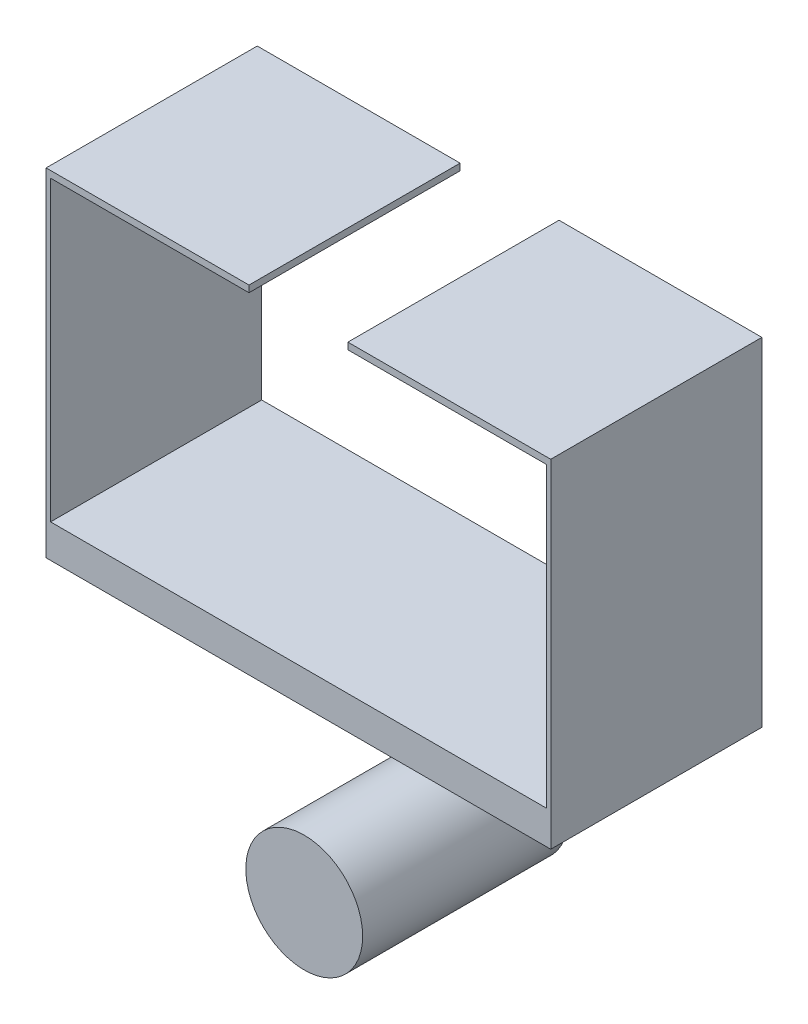
from build123d import *

# Parameters (mm, degrees)
SKETCH1_R           = 7.472749452
BOSS_EXTRUDE1_DEPTH = 25.4
BOSS_EXTRUDE2_DEPTH = 0.863350236
SKETCH4_W           = 63.40856
SKETCH4_H           = 4.26981756
BOSS_EXTRUDE3_DEPTH = 27.00421054
SKETCH6_W           = 27.00421054
SKETCH6_H           = 4.26981756
BOSS_EXTRUDE4_DEPTH = 0.56888896
SKETCH7_W           = 0.56888896
SKETCH7_H           = 27.00421054
BOSS_EXTRUDE5_DEPTH = 38.0746
SKETCH8_W           = 0.56888896
SKETCH8_H           = 27.00421054
BOSS_EXTRUDE6_DEPTH = 0.853447309
SKETCH9_W           = 27.00421054
SKETCH9_H           = 0.853447309
BOSS_EXTRUDE7_DEPTH = 25.37968


with BuildPart() as part:
    # Sketch1 → Boss-Extrude1 (new body)
    with BuildSketch(Plane.XY):
        Circle(SKETCH1_R)
    extrude(amount=-BOSS_EXTRUDE1_DEPTH)

    # Sketch2 → Boss-Extrude2 (add)
    with BuildSketch(Plane(origin=(0, 0, -25.4), x_dir=(-1, 0, 0), z_dir=(0, 0, -1))):
        with BuildLine():
            Line((-7.472749452, 22.418248356), (-7.472749452, 0))
            ThreePointArc((-7.472749452, 0), (0, -7.472749452), (7.472749452, 0))
            Line((7.472749452, 0), (7.472749452, 22.418248356))
            Line((7.472749452, 22.418248356), (-7.472749452, 22.418248356))
        make_face()
    extrude(amount=BOSS_EXTRUDE2_DEPTH)

    # Sketch4 → Boss-Extrude3 (add)
    with BuildSketch(Plane(origin=(0, 0, -26.263350236), x_dir=(-1, 0, 0), z_dir=(0, 0, -1))):
        with Locations((0, 24.553157136)):
            Rectangle(SKETCH4_W, SKETCH4_H)
    extrude(amount=-BOSS_EXTRUDE3_DEPTH)

    # Sketch6 → Boss-Extrude4 (add)
    with BuildSketch(Plane(origin=(31.70428, 0, 0), x_dir=(0, 0, -1), z_dir=(1, 0, 0))):
        with Locations((12.761244966, 24.553157136)):
            Rectangle(SKETCH6_W, SKETCH6_H)
    boss_extrude4 = extrude(amount=BOSS_EXTRUDE4_DEPTH)

    # Sketch7 → Boss-Extrude5 (add)
    with BuildSketch(Plane(origin=(0, 26.688065916, 0), x_dir=(1, 0, 0), z_dir=(0, 1, 0))):
        with Locations((31.98872448, 12.761244966)):
            Rectangle(SKETCH7_W, SKETCH7_H)
    boss_extrude5 = extrude(amount=BOSS_EXTRUDE5_DEPTH)

    # Sketch8 → Boss-Extrude6 (add)
    with BuildSketch(Plane(origin=(0, 64.762665916, 0), x_dir=(1, 0, 0), z_dir=(0, 1, 0))):
        with Locations((31.98872448, 12.761244966)):
            Rectangle(SKETCH8_W, SKETCH8_H)
    boss_extrude6 = extrude(amount=BOSS_EXTRUDE6_DEPTH)

    # Sketch9 → Boss-Extrude7 (add)
    with BuildSketch(Plane.ZY.offset(-31.70428)):
        with Locations((-12.761244966, 65.18938957)):
            Rectangle(SKETCH9_W, SKETCH9_H)
    boss_extrude7 = extrude(amount=BOSS_EXTRUDE7_DEPTH)

    # Mirror1: Boss-Extrude4, Boss-Extrude5, Boss-Extrude6, Boss-Extrude7 across plane
    add(boss_extrude4.mirror(Plane(origin=(0, 0, 0), x_dir=(0, 0, 1), z_dir=(1, 0, 0))))
    add(boss_extrude5.mirror(Plane(origin=(0, 0, 0), x_dir=(0, 0, 1), z_dir=(1, 0, 0))))
    add(boss_extrude6.mirror(Plane(origin=(0, 0, 0), x_dir=(0, 0, 1), z_dir=(1, 0, 0))))
    add(boss_extrude7.mirror(Plane(origin=(0, 0, 0), x_dir=(0, 0, 1), z_dir=(1, 0, 0))))


solid = part.part
